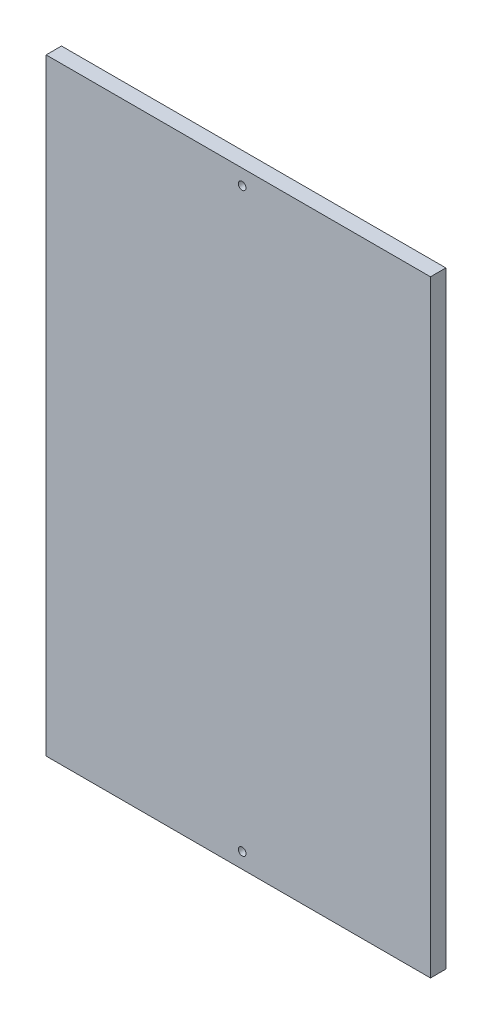
from build123d import *

# Parameters (mm, degrees)
ESQUISSE1_W        = 250
ESQUISSE1_H        = 395
ESQUISSE1_R        = 2.5
BOSS_EXTRU_1_DEPTH = 10


with BuildPart() as part:
    # Esquisse1 → Boss.-Extru.1 (new body)
    with BuildSketch(Plane.XY):
        with Locations((87.337784558, -123.852829028)):
            Rectangle(ESQUISSE1_W, ESQUISSE1_H)
        with Locations((89.837784558, 63.647170972)):
            Circle(ESQUISSE1_R, mode=Mode.SUBTRACT)
        with Locations((89.837784558, -311.352829028)):
            Circle(ESQUISSE1_R, mode=Mode.SUBTRACT)
    extrude(amount=BOSS_EXTRU_1_DEPTH)


solid = part.part
